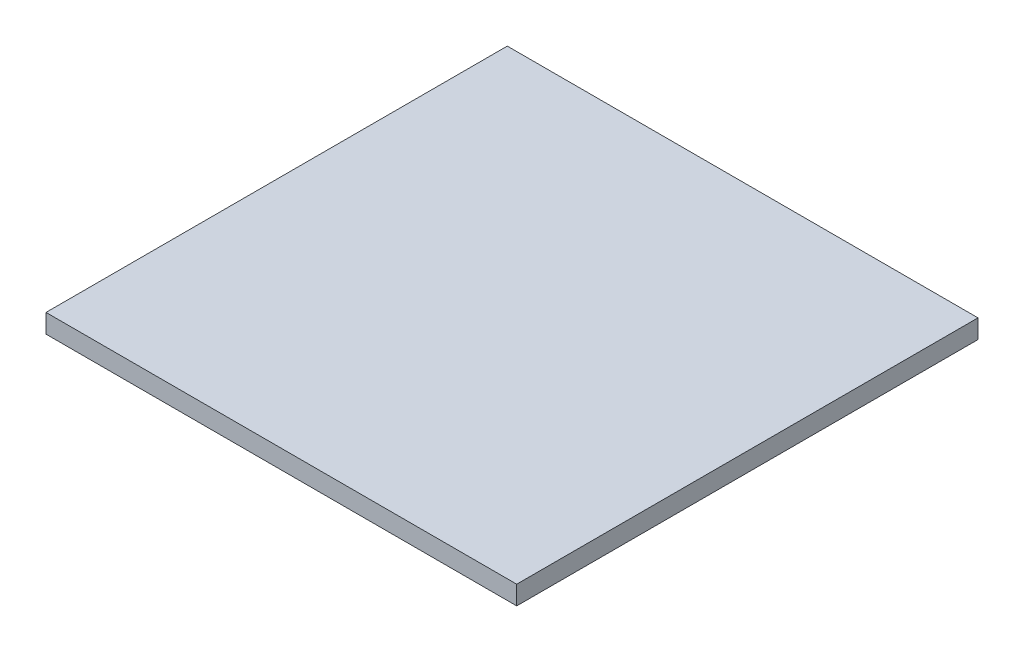
from build123d import *

# Parameters (mm, degrees)
SKETCH1_W           = 50
SKETCH1_H           = 49
BOSS_EXTRUDE1_DEPTH = 1


with BuildPart() as part:
    # Sketch1 → Boss-Extrude1 (new, symmetric)
    with BuildSketch(Plane(origin=(0, 0, 0), x_dir=(1, 0, 0), z_dir=(0, 1, 0))):
        Rectangle(SKETCH1_W, SKETCH1_H)
    extrude(amount=BOSS_EXTRUDE1_DEPTH, both=True)


solid = part.part
